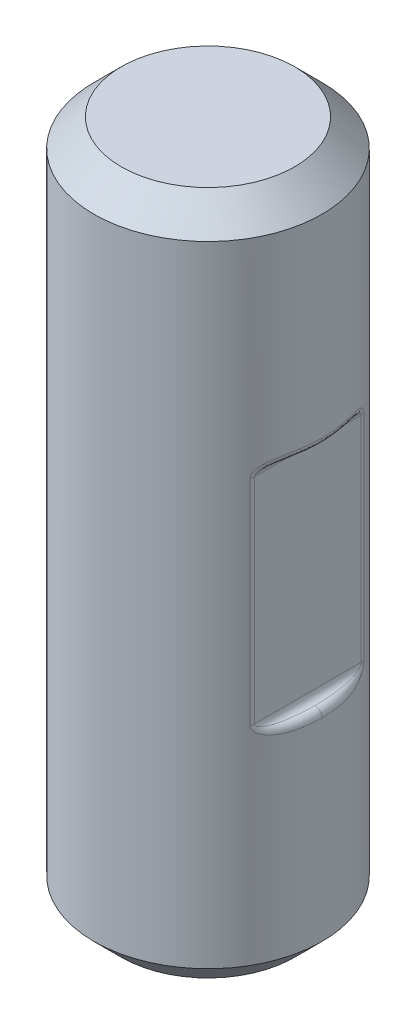
from build123d import *

# Parameters (mm, degrees)
SKETCH1_W               = 3.175
SKETCH1_H               = 19.05
CUT_EXTRUDE2_DEPTH      = 11.530283709
CUT_EXTRUDE2_DEPTH_BACK = 11.530283709
SKETCH3_W               = 0.396875
SKETCH3_H               = 6.35
FILLET3_R               = 0.1984375
CHAMFER1_SIZE           = 0.762


with BuildPart() as part:
    # Sketch1 → Revolve1 (revolve)
    with BuildSketch(Plane.XY, mode=Mode.PRIVATE) as revolve1_sk:
        with Locations((1.5875, 0)):
            Rectangle(SKETCH1_W, SKETCH1_H)
    revolve(revolve1_sk.sketch.rotate(Axis((0, 5.054239483, 0), (0, -1, 0)), 90), axis=Axis((0, 5.054239483, 0), (0, -1, 0)))

    # Sketch3 → Cut-Extrude2 (cut, two sides: drawn at the far end of the back side and taken through both)
    with BuildSketch(Plane.XY.offset(-CUT_EXTRUDE2_DEPTH_BACK)):
        with Locations((2.9765625, 0)):
            Rectangle(SKETCH3_W, SKETCH3_H)
    extrude(amount=CUT_EXTRUDE2_DEPTH + CUT_EXTRUDE2_DEPTH_BACK, mode=Mode.SUBTRACT)

    # Fillet3
    fillet3_edges = [part.edges().sort_by_distance(p)[0] for p in [
        (2.778125, -3.175, 0),
        (2.778125, 3.175, 0),
    ]]
    fillet(fillet3_edges, radius=FILLET3_R)
    fillet3_2_edges = [part.edges().sort_by_distance(p)[0] for p in [
        (2.778125, 0, 1.537090266),
        (2.778125, 0, -1.537090266),
        (2.842710111, 3.123058164, -1.414080692),
        (2.842706566, -3.123054925, -1.41408782),
        (2.842710111, 3.123058164, 1.414080692),
        (2.842706566, -3.123054925, 1.41408782),
    ]]
    fillet(fillet3_2_edges, radius=FILLET3_R - 0.0001)  # a hair under: the kernel refuses the full size

    # Chamfer1
    chamfer1_edges = [part.edges().sort_by_distance(p)[0] for p in [
        (0, -9.525, -3.175),
        (0, 9.525, -3.175),
    ]]
    chamfer(chamfer1_edges, length=CHAMFER1_SIZE)


solid = part.part
